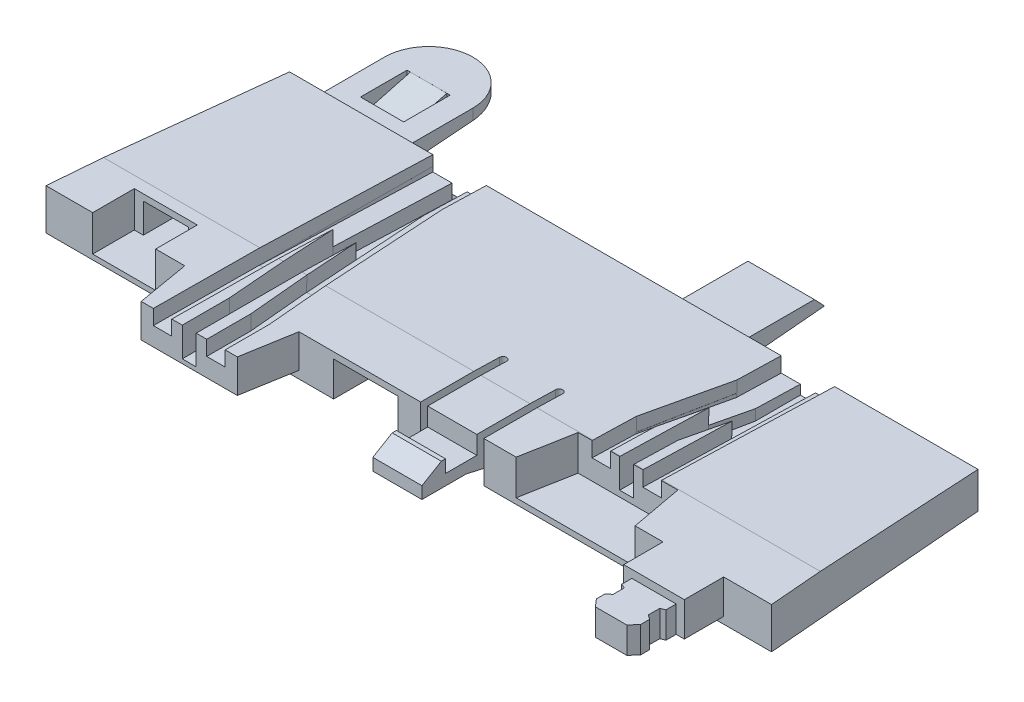
from build123d import *

# Parameters (mm, degrees)
BOSS_EXTRUDE1_DEPTH      = 9.25
CUT_EXTRUDE17_DEPTH      = 87.245768012
CUT_EXTRUDE17_DEPTH_BACK = 87.245768012
BOSS_EXTRUDE2_DEPTH      = 7.55
CUT_EXTRUDE12_DEPTH      = 3.36
CUT_EXTRUDE18_DEPTH      = 3.4
CUT_EXTRUDE13_DEPTH      = 6.6
CUT_EXTRUDE19_DEPTH      = 6.7
SKETCH3_W                = 14.22
SKETCH3_H                = 8.1
CUT_EXTRUDE2_DEPTH       = 9.4
CUT_EXTRUDE7_DEPTH       = 7.95
CUT_EXTRUDE14_REACH      = 92.46
CUT_EXTRUDE20_REACH      = 92.522
CUT_EXTRUDE15_REACH      = 92.461
SKETCH4_W                = 10.16
SKETCH4_H                = 6.68
CUT_EXTRUDE3_DEPTH       = 12
SKETCH7_W                = 33.91
SKETCH7_H                = 7.83
CUT_EXTRUDE5_DEPTH       = 20
CUT_EXTRUDE6_DEPTH       = 91.459775038
SKETCH12_W               = 11.09
SKETCH12_H               = 1.42
BOSS_EXTRUDE5_DEPTH      = 4.16
BOSS_EXTRUDE9_DEPTH      = 11.09
BOSS_EXTRUDE10_DEPTH     = 2.66
CUT_EXTRUDE8_REACH       = 106.674
SKETCH19_W               = 13.69
SKETCH19_H               = 8.88
BOSS_EXTRUDE11_DEPTH     = 7.72
BOSS_EXTRUDE12_DEPTH     = 5.95
BOSS_EXTRUDE15_DEPTH     = 7.83
SKETCH26_W               = 11.09
SKETCH26_H               = 3.67
BOSS_EXTRUDE16_DEPTH     = 13.81
SKETCH33_W               = 16
SKETCH33_H               = 5.83
CUT_EXTRUDE16_DEPTH      = 22
SKETCH38_W               = 15
SKETCH38_H               = 3.62
BOSS_EXTRUDE17_DEPTH     = 19.66
CUT_EXTRUDE25_DEPTH      = 116.110540351
CUT_EXTRUDE25_DEPTH_BACK = 116.110540351
CUT_EXTRUDE21_DEPTH      = 102.537365044
CUT_EXTRUDE21_DEPTH_BACK = 102.537365044
SKETCH40_W               = 20
SKETCH40_H               = 4.4
CUT_EXTRUDE22_DEPTH      = 28
CUT_EXTRUDE23_REACH      = 95.833
SKETCH41_W               = 20
SKETCH41_H               = 22.4
BOSS_EXTRUDE18_DEPTH     = 9.975
FILLET1_START            = 2.12
FILLET1_DEPTH            = 3.67
CUT_EXTRUDE24_DEPTH      = 97.86637239
CUT_EXTRUDE24_DEPTH_BACK = 97.86637239
SKETCH43_W               = 9.75
SKETCH43_H               = 10.5
BOSS_EXTRUDE19_DEPTH     = 4.125
CUT_EXTRUDE26_REACH      = 112.399


with BuildPart() as part:
    # Sketch1 → Boss-Extrude1 (new body)
    with BuildSketch(Plane(origin=(0, 0, 0), x_dir=(1, 0, 0), z_dir=(0, 1, 0))):
        Polygon((-81.9, -25.4), (-77.72, 25.4), (77.72, 25.4), (81.9, -25.4), align=None)
    extrude(amount=BOSS_EXTRUDE1_DEPTH)

    # Sketch34 → Cut-Extrude17 (cut, two sides: drawn at the far end of the back side and taken through both)
    with BuildSketch(Plane(origin=(0, 0, 0), x_dir=(0, 0, -1), z_dir=(1, 0, 0)).offset(-CUT_EXTRUDE17_DEPTH_BACK)):
        Polygon((-13.4, 9.25), (25.4, 8.2), (25.4, 9.25), align=None)
    extrude(amount=CUT_EXTRUDE17_DEPTH + CUT_EXTRUDE17_DEPTH_BACK, mode=Mode.SUBTRACT)

    # Sketch5 → Boss-Extrude2 (add)
    with BuildSketch(Plane(origin=(0, 9.25, 0), x_dir=(1, 0, 0), z_dir=(0, 1, 0))):
        Polygon((-50.57, -25.4), (-48.53, -37.28), (-26.83, -37.28), (-24.79, -25.4), align=None)
    extrude(amount=-BOSS_EXTRUDE2_DEPTH)

    # Sketch29 → Cut-Extrude12 (cut)
    with BuildSketch(Plane(origin=(0, 9.25, 0), x_dir=(1, 0, 0), z_dir=(0, 1, 0))):
        Polygon((-45.79, -37.28), (-45.35, 25.4), (-41.03, 25.4), (-41.63, -37.28), align=None)
        Polygon((-37.61, 25.4), (-33.29, 25.4), (-33.29, 15.4), (-29.57, -27.28), (-29.57, -37.28), (-33.73, -37.28), (-33.73, -27.28), (-37.61, 15.4), align=None)
    extrude(amount=-CUT_EXTRUDE12_DEPTH, mode=Mode.SUBTRACT)

    # Sketch35 → Cut-Extrude18 (cut)
    with BuildSketch(Plane(origin=(0, 8.880867284, -0.240332749), x_dir=(1, 0, 0), z_dir=(0, 0.9996340289840994, -0.027051951815291363))):
        Polygon((-41.011728483, 27.0783416), (-41.401410338, -13.645326543), (-45.622367581, -13.645326543), (-45.336614958, 27.076336412), align=None)
        Polygon((-34.991818182, -13.645326543), (-30.779784442, -13.645326543), (-33.29, 15.165217281), (-33.29, 27.0783416), (-37.61, 27.0783416), (-37.61, 15.165217281), align=None)
    extrude(amount=-CUT_EXTRUDE18_DEPTH, mode=Mode.SUBTRACT)

    # Sketch30 → Cut-Extrude13 (cut)
    with BuildSketch(Plane(origin=(0, 9.25, 0), x_dir=(1, 0, 0), z_dir=(0, 1, 0))):
        Polygon((-39.255, -37.28), (-39.255, -26.646976636), (-41.285076356, -1.246976636), (-41.03, 25.4), (-37.61, 25.4), (-37.61, 15.4), (-36.105, -1.246976636), (-36.105, -37.28), align=None)
    extrude(amount=-CUT_EXTRUDE13_DEPTH, mode=Mode.SUBTRACT)

    # Sketch36 → Cut-Extrude19 (cut)
    with BuildSketch(Plane(origin=(0, 8.880867284, -0.240332749), x_dir=(1, 0, 0), z_dir=(0, 0.9996340289840994, -0.027051951815291363))):
        Polygon((-37.61, 25.319016664), (-41.03, 25.319016664), (-41.285076356, -1.318207951), (-40.299479751, -13.645326543), (-36.105, -13.645326543), (-36.105, -1.318207951), (-37.61, 15.322676374), align=None)
    extrude(amount=-CUT_EXTRUDE19_DEPTH, mode=Mode.SUBTRACT)

    # Sketch3 → Cut-Extrude2 (cut)
    with BuildSketch(Plane.XY.offset(25.4)):
        with Locations((-64.25, 5.2)):
            Rectangle(SKETCH3_W, SKETCH3_H)
    extrude(amount=-CUT_EXTRUDE2_DEPTH, mode=Mode.SUBTRACT)

    # Sketch9 → Cut-Extrude7 (cut)
    with BuildSketch(Plane(origin=(0, 9.25, 0), x_dir=(1, 0, 0), z_dir=(0, 1, 0))):
        Polygon((24.25, -25.4), (26.43, -13.58), (48.93, -13.58), (51.11, -25.4), align=None)
    extrude(amount=-CUT_EXTRUDE7_DEPTH, mode=Mode.SUBTRACT)

    # Cut-Extrude14: up to this face of the body (flat: up to its plane)
    cut_extrude14_end = Plane(part.part.faces().sort_by_distance((-32.007413034, 5.89, 25.307147885))[0])
    # Sketch31 → Cut-Extrude14 (cut, up to the picked face)
    with BuildSketch(Plane(origin=(0, 9.25, 0), x_dir=(1, 0, 0), z_dir=(0, 1, 0)), mode=Mode.PRIVATE) as cut_extrude14_sk1:
        Polygon((33.29, 25.4), (37.61, 25.4), (37.61, 15.4), (33.73, -3.58), (33.73, -13.58), (29.57, -13.58), (29.57, -3.58), (33.29, 15.4), align=None)
    cut_extrude14_tool1 = split(extrude(cut_extrude14_sk1.sketch, amount=-CUT_EXTRUDE14_REACH, mode=Mode.PRIVATE), bisect_by=cut_extrude14_end, keep=Keep.BOTH, mode=Mode.PRIVATE)
    # Sketch31 → Cut-Extrude14 (cut, up to the picked face)
    with BuildSketch(Plane(origin=(0, 9.25, 0), x_dir=(1, 0, 0), z_dir=(0, 1, 0)), mode=Mode.PRIVATE) as cut_extrude14_sk2:
        Polygon((45.19, -13.58), (45.35, 25.4), (41.03, 25.4), (41.03, -13.58), align=None)
    cut_extrude14_tool2 = split(extrude(cut_extrude14_sk2.sketch, amount=-CUT_EXTRUDE14_REACH, mode=Mode.PRIVATE), bisect_by=cut_extrude14_end, keep=Keep.BOTH, mode=Mode.PRIVATE)
    add(cut_extrude14_tool1.solids().sort_by(Axis((33.574212, 9.25, -6.079337), (0, -1, 0)))[0], mode=Mode.SUBTRACT)
    add(cut_extrude14_tool2.solids().sort_by(Axis((43.150252, 9.25, -6.032579), (0, -1, 0)))[0], mode=Mode.SUBTRACT)

    # Cut-Extrude20: up to this face of the body (flat: up to its plane)
    cut_extrude20_end = Plane(part.part.faces().sort_by_distance((-34.505098461, 5.322568193, -6.043864333))[0])
    # Sketch37 → Cut-Extrude20 (cut, up to the picked face)
    with BuildSketch(Plane(origin=(0, 8.880867284, -0.240332749), x_dir=(1, 0, 0), z_dir=(0, 0.9996340289840994, -0.027051951815291363)), mode=Mode.PRIVATE) as cut_extrude20_sk1:
        Polygon((29.57, -13.73436611), (33.73, -13.73436611), (33.73, -3.821731392), (37.61, 15.165217281), (37.61, 27.29536055), (33.29, 27.29536055), (33.29, 15.165217281), (29.57, -3.821731392), align=None)
    cut_extrude20_tool1 = split(extrude(cut_extrude20_sk1.sketch, amount=-CUT_EXTRUDE20_REACH, mode=Mode.PRIVATE), bisect_by=cut_extrude20_end, keep=Keep.BOTH, mode=Mode.PRIVATE)
    # Sketch37 → Cut-Extrude20 (cut, up to the picked face)
    with BuildSketch(Plane(origin=(0, 8.880867284, -0.240332749), x_dir=(1, 0, 0), z_dir=(0, 0.9996340289840994, -0.027051951815291363)), mode=Mode.PRIVATE) as cut_extrude20_sk2:
        Polygon((41.03, -13.73436611), (45.19, -13.73436611), (45.358475107, 27.29536055), (41.03, 27.29536055), align=None)
    cut_extrude20_tool2 = split(extrude(cut_extrude20_sk2.sketch, amount=-CUT_EXTRUDE20_REACH, mode=Mode.PRIVATE), bisect_by=cut_extrude20_end, keep=Keep.BOTH, mode=Mode.PRIVATE)
    add(cut_extrude20_tool1.solids().sort_by(Axis((33.677348, 8.6926, -7.197257), (0, -0.9996340289840994, 0.027051951815291363)))[0], mode=Mode.SUBTRACT)
    add(cut_extrude20_tool2.solids().sort_by(Axis((43.152397, 8.69377, -7.154022), (0, -0.9996340289840994, 0.027051951815291363)))[0], mode=Mode.SUBTRACT)

    # Cut-Extrude15: up to this plane
    cut_extrude15_end = Plane(origin=(0, 2.65, 0), z_dir=(0, 1, 0))
    # Sketch32 → Cut-Extrude15 (cut, up to the surface)
    with BuildSketch(Plane(origin=(0, 8.88486488, -0.092612065), x_dir=(1, 0, 0), z_dir=(0, 0.9996340289840994, -0.027051951815291363)), mode=Mode.PRIVATE) as cut_extrude15_sk1:
        Polygon((35.805, -13.677485903), (35.805, 6.480146078), (37.61, 15.312992046), (37.61, 25.525599344), (41.030098814, 25.525599344), (41.03, 6.480146078), (38.955, -3.673956627), (38.955, -13.677485903), align=None)
    cut_extrude15_tool1 = split(extrude(cut_extrude15_sk1.sketch, amount=-CUT_EXTRUDE15_REACH, mode=Mode.PRIVATE), bisect_by=cut_extrude15_end, keep=Keep.BOTH, mode=Mode.PRIVATE)
    add(cut_extrude15_tool1.solids().sort_by_distance((38.380972, 8.715425, -6.353817))[0], mode=Mode.SUBTRACT)

    # Sketch4 → Cut-Extrude3 (cut)
    with BuildSketch(Plane.XY.offset(16)):
        with Locations((-64.25, 4.49)):
            Rectangle(SKETCH4_W, SKETCH4_H)
    extrude(amount=-CUT_EXTRUDE3_DEPTH, mode=Mode.SUBTRACT)

    # Sketch7 → Cut-Extrude5 (cut)
    with BuildSketch(Plane.XY.offset(25.4)):
        with Locations((0, 3.915)):
            Rectangle(SKETCH7_W, SKETCH7_H)
    extrude(amount=-CUT_EXTRUDE5_DEPTH, mode=Mode.SUBTRACT)

    # Sketch8 → Cut-Extrude6 (cut, through all)
    with BuildSketch(Plane(origin=(0, 9.25, 0), x_dir=(1, 0, 0), z_dir=(0, 1, 0))):
        with BuildLine():
            Line((2.685, -25.4), (4.275, -25.4))
            Line((4.275, -25.4), (4.275, -7.59))
            ThreePointArc((4.275, -7.59), (3.48, -6.795), (2.685, -7.59))
            Line((2.685, -7.59), (2.685, -25.4))
        make_face()
        with BuildLine():
            Line((15.365, -25.4), (15.365, -7.59))
            ThreePointArc((15.365, -7.59), (16.16, -6.795), (16.955, -7.59))
            Line((16.955, -7.59), (16.955, -25.4))
            Line((16.955, -25.4), (15.365, -25.4))
        make_face()
    extrude(amount=-CUT_EXTRUDE6_DEPTH, mode=Mode.SUBTRACT)

    # Sketch12 → Boss-Extrude5 (add)
    with BuildSketch(Plane.XZ.offset(-7.83)):
        with Locations((9.82, 24.69)):
            Rectangle(SKETCH12_W, SKETCH12_H)
    extrude(amount=BOSS_EXTRUDE5_DEPTH)

    # Sketch16 → Boss-Extrude9 (add)
    with BuildSketch(Plane.ZY.offset(-4.275)):
        Polygon((25.4, 5.15), (25.4, 3.67), (37.79, 3.67), (37.79, 5.42), (33.41, 8.01), (32.46, 8.01), (32.46, 5.15), align=None)
    extrude(amount=-BOSS_EXTRUDE9_DEPTH)

    # Sketch17 → Boss-Extrude10 (add)
    with BuildSketch(Plane.XZ.offset(-7.83)):
        Polygon((-4.365, 24.65), (-4.365, 18.78), (-15.275, 18.78), (-15.275, 24.65), (-14.045, 24.65), (-14.045, 20.33), (-5.595, 20.33), (-5.595, 24.65), align=None)
    extrude(amount=BOSS_EXTRUDE10_DEPTH)

    # Cut-Extrude8: up to this face of the body (flat: up to its plane)
    cut_extrude8_end = Plane(part.part.faces().sort_by_distance((-4.365, 6.5, 21.715))[0])
    # Sketch18 → Cut-Extrude8 (cut, up to the picked face)
    with BuildSketch(Plane.ZY.offset(15.275), mode=Mode.PRIVATE) as cut_extrude8_sk1:
        Polygon((24.65, 5.17), (24.65, 7.83), (20.33, 5.17), align=None)
    cut_extrude8_tool1 = split(extrude(cut_extrude8_sk1.sketch, amount=-CUT_EXTRUDE8_REACH, mode=Mode.PRIVATE), bisect_by=cut_extrude8_end, keep=Keep.BOTH, mode=Mode.PRIVATE)
    add(cut_extrude8_tool1.solids().sort_by(Axis((-15.275, 6.056667, 23.21), (1, 0, 0)))[0], mode=Mode.SUBTRACT)

    # Sketch19 → Boss-Extrude11 (add)
    with BuildSketch(Plane(origin=(0, 9.25, 0), x_dir=(1, 0, 0), z_dir=(0, 1, 0))):
        with Locations((64.25, -29.84)):
            Rectangle(SKETCH19_W, SKETCH19_H)
    extrude(amount=-BOSS_EXTRUDE11_DEPTH)

    # Sketch20 → Boss-Extrude12 (add)
    with BuildSketch(Plane.XZ.offset(-1.53)):
        Polygon((69.25, 34.28), (69.25, 36.58), (68.25, 36.98), (68.25, 39.55), (69.25, 40.28), (69.25, 42.28), (67.8, 43.96), (60.7, 43.96), (59.25, 42.28), (59.25, 40.28), (60.25, 39.55), (60.25, 36.98), (59.25, 36.58), (59.25, 34.28), align=None)
    extrude(amount=-BOSS_EXTRUDE12_DEPTH)

    # Sketch25 → Boss-Extrude15 (add)
    with BuildSketch(Plane.XZ.offset(-7.83)):
        with BuildLine():
            Line((2.685, 25.4), (-2.455, 25.4))
            Line((-2.455, 25.4), (-2.455, 5.4))
            Line((-2.455, 5.4), (16.955, 5.4))
            Line((16.955, 5.4), (16.955, 7.59))
            ThreePointArc((16.955, 7.59), (16.16, 6.795), (15.365, 7.59))
            Line((15.365, 7.59), (15.365, 23.98))
            Line((15.365, 23.98), (4.275, 23.98))
            Line((4.275, 23.98), (4.275, 7.59))
            ThreePointArc((4.275, 7.59), (3.48, 6.795), (2.685, 7.59))
            Line((2.685, 7.59), (2.685, 25.4))
        make_face()
    extrude(amount=BOSS_EXTRUDE15_DEPTH)

    # Sketch26 → Boss-Extrude16 (add)
    with BuildSketch(Plane.XY.offset(23.98)):
        with Locations((9.82, 1.835)):
            Rectangle(SKETCH26_W, SKETCH26_H)
    extrude(amount=BOSS_EXTRUDE16_DEPTH)

    # Sketch33 → Cut-Extrude16 (cut)
    with BuildSketch(Plane(origin=(0, 0, -25.4), x_dir=(-1, 0, 0), z_dir=(0, 0, -1))):
        with Locations((16.12, 2.915)):
            Rectangle(SKETCH33_W, SKETCH33_H)
    extrude(amount=-CUT_EXTRUDE16_DEPTH, mode=Mode.SUBTRACT)

    # Sketch38 → Boss-Extrude17 (add)
    with BuildSketch(Plane(origin=(0, 0, -25.4), x_dir=(-1, 0, 0), z_dir=(0, 0, -1))):
        with Locations((-16.12, 3.96)):
            Rectangle(SKETCH38_W, SKETCH38_H)
    extrude(amount=BOSS_EXTRUDE17_DEPTH)

    # Sketch45 → Cut-Extrude25 (cut, two sides: drawn at the far end of the back side and taken through both)
    with BuildSketch(Plane(origin=(23.62, 0, 0), x_dir=(0, 0, -1), z_dir=(1, 0, 0)).offset(-CUT_EXTRUDE25_DEPTH_BACK)):
        Polygon((31.4, 2.15), (45.06, 3.39), (45.06, 2.15), align=None)
    extrude(amount=CUT_EXTRUDE25_DEPTH + CUT_EXTRUDE25_DEPTH_BACK, mode=Mode.SUBTRACT)

    # Sketch39 → Cut-Extrude21 (cut, two sides: drawn at the far end of the back side and taken through both)
    with BuildSketch(Plane.ZY.offset(-8.62).offset(-CUT_EXTRUDE21_DEPTH_BACK)):
        Polygon((-42.56, 5.77), (-45.06, 3.15), (-45.06, 5.77), align=None)
    extrude(amount=CUT_EXTRUDE21_DEPTH + CUT_EXTRUDE21_DEPTH_BACK, mode=Mode.SUBTRACT)

    # Sketch40 → Cut-Extrude22 (cut)
    with BuildSketch(Plane(origin=(0, 0, -25.4), x_dir=(-1, 0, 0), z_dir=(0, 0, -1))):
        with Locations((-62.32, 4)):
            Rectangle(SKETCH40_W, SKETCH40_H)
    extrude(amount=-CUT_EXTRUDE22_DEPTH, mode=Mode.SUBTRACT)

    # Sketch41 → Cut-Extrude23 (cut, up to next)
    with BuildSketch(Plane.XZ, mode=Mode.PRIVATE) as cut_extrude23_sk1:
        with Locations((62.32, -8.6)):
            Rectangle(SKETCH41_W, SKETCH41_H)
    cut_extrude23_tool1 = extrude(cut_extrude23_sk1.sketch, amount=-CUT_EXTRUDE23_REACH, mode=Mode.PRIVATE) & part.part
    add(cut_extrude23_tool1.solids().sort_by_distance((62.32, 0, -8.6))[0], mode=Mode.SUBTRACT)

    # Sketch42 → Boss-Extrude18 (add, symmetric)
    with BuildSketch(Plane(origin=(-62.32, 0, 0), x_dir=(0, 0, -1), z_dir=(1, 0, 0))):
        Polygon((25.4, 2.12), (51.4, 4.09), (51.4, 5.79), (25.4, 5.79), align=None)
    extrude(amount=BOSS_EXTRUDE18_DEPTH, both=True)

    # Fillet1: read off the stored shape, not the designer's step
    # Fillet1 outline → Fillet1 (cut)
    with BuildSketch(Plane(origin=(0, 0, 0), x_dir=(1, 0, 0), z_dir=(0, 1, 0)).offset(FILLET1_START)):
        with BuildLine():
            ThreePointArc((-72.295, 41.425), (-69.373390142, 48.478390142), (-62.32, 51.4))
            Line((-62.32, 51.4), (-72.295, 51.4))
            Line((-72.295, 51.4), (-72.295, 41.425))
        make_face()
        with BuildLine():
            ThreePointArc((-62.32, 51.4), (-55.266609858, 48.478390142), (-52.345, 41.425))
            Line((-52.345, 41.425), (-52.345, 51.4))
            Line((-52.345, 51.4), (-62.32, 51.4))
        make_face()
    extrude(amount=FILLET1_DEPTH, mode=Mode.SUBTRACT)

    # Sketch43 → Cut-Extrude24 (cut, two sides: drawn at the far end of the back side and taken through both)
    with BuildSketch(Plane(origin=(0, 5.79, 0), x_dir=(1, 0, 0), z_dir=(0, 1, 0)).offset(-CUT_EXTRUDE24_DEPTH_BACK)):
        with Locations((-62.32, 36.15)):
            Rectangle(SKETCH43_W, SKETCH43_H)
    extrude(amount=CUT_EXTRUDE24_DEPTH + CUT_EXTRUDE24_DEPTH_BACK, mode=Mode.SUBTRACT)

    # Sketch44 → Boss-Extrude19 (add, symmetric)
    with BuildSketch(Plane(origin=(-62.32, 0, 0), x_dir=(0, 0, -1), z_dir=(1, 0, 0))):
        Polygon((41.425, 5.79), (31.9, 3.25), (31.9, 0.706730769), (45.24, 3.623261538), (41.425, 3.334201923), align=None)
    extrude(amount=BOSS_EXTRUDE19_DEPTH, both=True)

    # Cut-Extrude26: up to this face of the body (flat: up to its plane)
    cut_extrude26_end = Plane(part.part.faces().sort_by_distance((4.275, 4.131039974, 21.283978155))[0])
    # Sketch46 → Cut-Extrude26 (cut, up to the picked face)
    with BuildSketch(Plane(origin=(15.365, 0, 0), x_dir=(0, 0, -1), z_dir=(1, 0, 0)), mode=Mode.PRIVATE) as cut_extrude26_sk1:
        Polygon((-37.79, 2.71), (-37.79, 0), (-7.59, 0), (-7.59, 1.5), (-22.58997, 1.53), (-27.79, 2.71), align=None)
    cut_extrude26_tool1 = split(extrude(cut_extrude26_sk1.sketch, amount=-CUT_EXTRUDE26_REACH, mode=Mode.PRIVATE), bisect_by=cut_extrude26_end, keep=Keep.BOTH, mode=Mode.PRIVATE)
    add(cut_extrude26_tool1.solids().sort_by(Axis((15.365, 1.083377, 24.855712), (-1, 0, 0)))[0], mode=Mode.SUBTRACT)


solid = part.part
